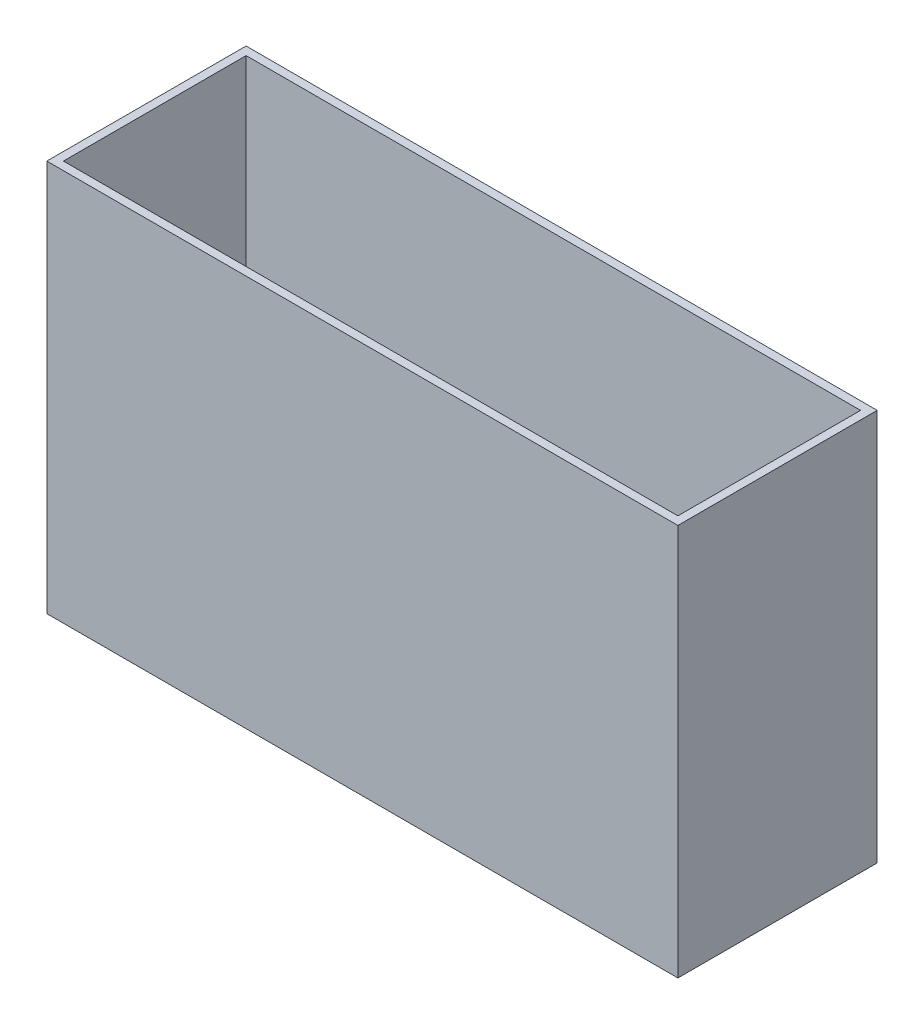
from build123d import *

# Parameters (mm, degrees)
SKETCH1_W           = 241.3
SKETCH1_H           = 76.2
SKETCH1_W_2         = 205.74
SKETCH1_H_2         = 5.588
BOSS_EXTRUDE1_DEPTH = 149.86
SHELL1_T            = -3.175
CUT_EXTRUDE1_REACH  = 281.957
CUT_EXTRUDE1_START  = -73.025


with BuildPart() as part:
    # Sketch1 → Boss-Extrude1 (new body)
    with BuildSketch(Plane(origin=(0, 0, 0), x_dir=(1, 0, 0), z_dir=(0, 1, 0))):
        Rectangle(SKETCH1_W, SKETCH1_H)
        Rectangle(SKETCH1_W_2, SKETCH1_H_2, mode=Mode.SUBTRACT)
    extrude(amount=BOSS_EXTRUDE1_DEPTH)

    # Shell1
    shell1_openings = [part.faces().sort_by_distance(p)[0] for p in [
        (0, 0, -35.569542927),
        (0, 74.93, -2.794),
        (0, 74.93, 2.794),
        (-102.87, 74.93, 0),
        (102.87, 74.93, 0),
        (0, 149.86, -35.569542927),
    ]]
    offset(amount=SHELL1_T, openings=shell1_openings, kind=Kind.INTERSECTION)

    # Sketch3 → Cut-Extrude1 (cut, up to next)
    with BuildSketch(Plane.XY.offset(38.1).offset(CUT_EXTRUDE1_START), mode=Mode.PRIVATE) as cut_extrude1_sk1:
        Polygon((107.95, 52.944691481), (66.675, 28.786196813), (107.95, 14.844691481), align=None)
    cut_extrude1_tool1 = extrude(cut_extrude1_sk1.sketch, amount=-CUT_EXTRUDE1_REACH, mode=Mode.PRIVATE) & part.part
    # Sketch3 → Cut-Extrude1 (cut, up to next)
    with BuildSketch(Plane.XY.offset(38.1).offset(CUT_EXTRUDE1_START), mode=Mode.PRIVATE) as cut_extrude1_sk2:
        Polygon((98.425, 12.7), (60.325, 25.569081846), (22.225, 12.7), align=None)
    cut_extrude1_tool2 = extrude(cut_extrude1_sk2.sketch, amount=-CUT_EXTRUDE1_REACH, mode=Mode.PRIVATE) & part.part
    # Sketch3 → Cut-Extrude1 (cut, up to next)
    with BuildSketch(Plane.XY.offset(38.1).offset(CUT_EXTRUDE1_START), mode=Mode.PRIVATE) as cut_extrude1_sk3:
        Polygon((97.597199346, 52.771327471), (60.325, 30.955695027), (23.052800654, 52.771327471), align=None)
    cut_extrude1_tool3 = extrude(cut_extrude1_sk3.sketch, amount=-CUT_EXTRUDE1_REACH, mode=Mode.PRIVATE) & part.part
    # Sketch3 → Cut-Extrude1 (cut, up to next)
    with BuildSketch(Plane.XY.offset(38.1).offset(CUT_EXTRUDE1_START), mode=Mode.PRIVATE) as cut_extrude1_sk4:
        Polygon((53.975, 28.786196813), (12.7, 14.844691481), (12.7, 52.944691481), align=None)
    cut_extrude1_tool4 = extrude(cut_extrude1_sk4.sketch, amount=-CUT_EXTRUDE1_REACH, mode=Mode.PRIVATE) & part.part
    # Sketch3 → Cut-Extrude1 (cut, up to next)
    with BuildSketch(Plane.XY.offset(38.1).offset(CUT_EXTRUDE1_START), mode=Mode.PRIVATE) as cut_extrude1_sk5:
        Polygon((-107.95, 52.944691481), (-66.675, 28.786196813), (-107.95, 14.844691481), align=None)
    cut_extrude1_tool5 = extrude(cut_extrude1_sk5.sketch, amount=-CUT_EXTRUDE1_REACH, mode=Mode.PRIVATE) & part.part
    # Sketch3 → Cut-Extrude1 (cut, up to next)
    with BuildSketch(Plane.XY.offset(38.1).offset(CUT_EXTRUDE1_START), mode=Mode.PRIVATE) as cut_extrude1_sk6:
        Polygon((-22.225, 12.7), (-60.325, 25.569081846), (-98.425, 12.7), align=None)
    cut_extrude1_tool6 = extrude(cut_extrude1_sk6.sketch, amount=-CUT_EXTRUDE1_REACH, mode=Mode.PRIVATE) & part.part
    # Sketch3 → Cut-Extrude1 (cut, up to next)
    with BuildSketch(Plane.XY.offset(38.1).offset(CUT_EXTRUDE1_START), mode=Mode.PRIVATE) as cut_extrude1_sk7:
        Polygon((-12.7, 52.944691481), (-53.975, 28.786196813), (-12.7, 14.844691481), align=None)
    cut_extrude1_tool7 = extrude(cut_extrude1_sk7.sketch, amount=-CUT_EXTRUDE1_REACH, mode=Mode.PRIVATE) & part.part
    # Sketch3 → Cut-Extrude1 (cut, up to next)
    with BuildSketch(Plane.XY.offset(38.1).offset(CUT_EXTRUDE1_START), mode=Mode.PRIVATE) as cut_extrude1_sk8:
        Polygon((-97.597199346, 52.771327471), (-60.325, 30.955695027), (-23.052800654, 52.771327471), align=None)
    cut_extrude1_tool8 = extrude(cut_extrude1_sk8.sketch, amount=-CUT_EXTRUDE1_REACH, mode=Mode.PRIVATE) & part.part
    add(cut_extrude1_tool1.solids().sort_by_distance((94.191667, 32.19186, -34.925))[0], mode=Mode.SUBTRACT)
    add(cut_extrude1_tool2.solids().sort_by_distance((60.325, 16.989694, -34.925))[0], mode=Mode.SUBTRACT)
    add(cut_extrude1_tool3.solids().sort_by_distance((60.325, 45.49945, -34.925))[0], mode=Mode.SUBTRACT)
    add(cut_extrude1_tool4.solids().sort_by_distance((26.458333, 32.19186, -34.925))[0], mode=Mode.SUBTRACT)
    add(cut_extrude1_tool5.solids().sort_by_distance((-94.191667, 32.19186, -34.925))[0], mode=Mode.SUBTRACT)
    add(cut_extrude1_tool6.solids().sort_by_distance((-60.325, 16.989694, -34.925))[0], mode=Mode.SUBTRACT)
    add(cut_extrude1_tool7.solids().sort_by_distance((-26.458333, 32.19186, -34.925))[0], mode=Mode.SUBTRACT)
    add(cut_extrude1_tool8.solids().sort_by_distance((-60.325, 45.49945, -34.925))[0], mode=Mode.SUBTRACT)


solid = part.part
